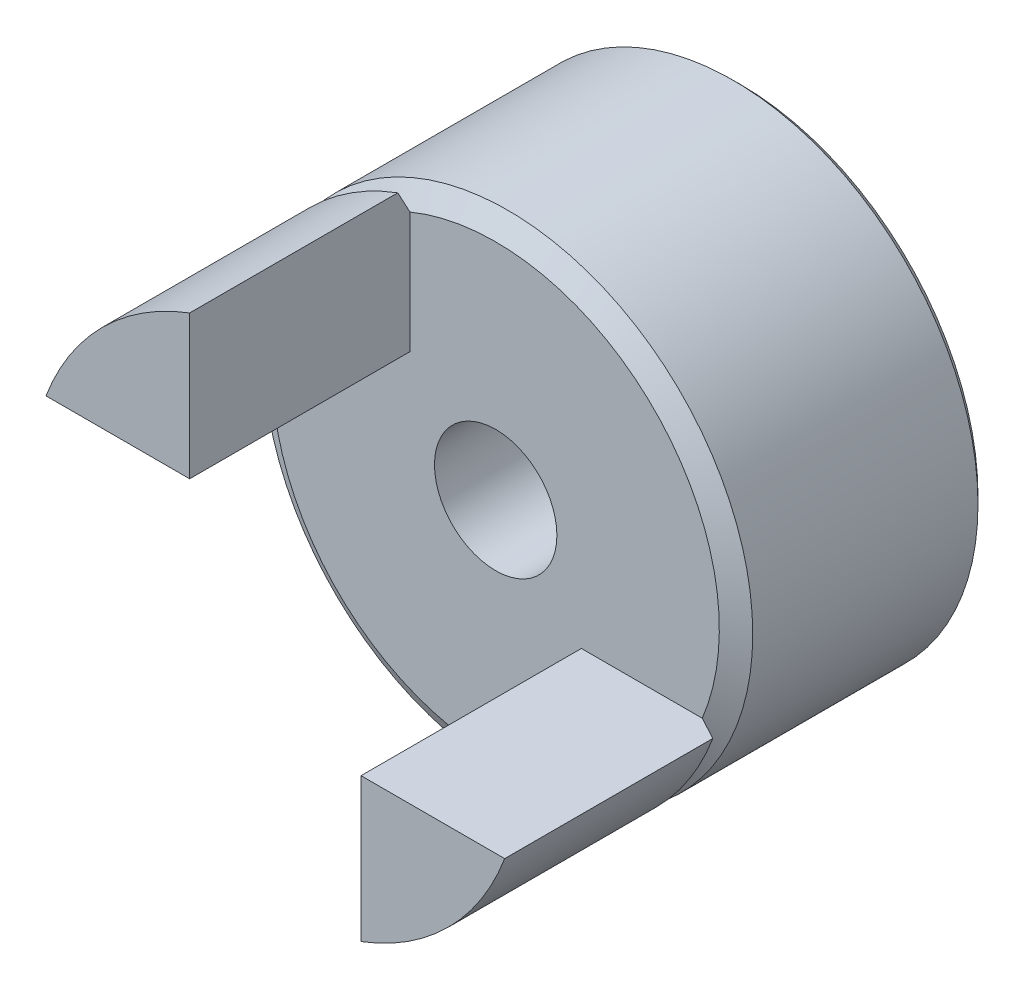
from build123d import *

# Parameters (mm, degrees)
SKETCH_1_R      = 10
SKETCH_1_R_2    = 2.5
EXTRUDE_1_DEPTH = 10
CHAMFER_1_SIZE  = 0.3
EXTRUDE_2_DEPTH = 9


with BuildPart() as part:
    # 스케치1 → 보스-돌출1 (new body)
    with BuildSketch(Plane.XY):
        Circle(SKETCH_1_R)
        Circle(SKETCH_1_R_2, mode=Mode.SUBTRACT)
    extrude(amount=EXTRUDE_1_DEPTH)

    # 모따기1
    chamfer_1_edges = [part.edges().sort_by_distance(p)[0] for p in [
        (-2.5, 0, 0),
        (-10, 0, 0),
    ]]
    chamfer(chamfer_1_edges, length=CHAMFER_1_SIZE)

    # 스케치2 → 보스-돌출2 (add)
    with BuildSketch(Plane.XY.offset(10)):
        with BuildLine():
            ThreePointArc((-3.5, 9.367496998), (-7.071067812, 7.071067812), (-9.367496998, 3.5))
            Line((-9.367496998, 3.5), (-3.5, 3.5))
            Line((-3.5, 3.5), (-3.5, 9.367496998))
        make_face()
        with BuildLine():
            Line((9.367496998, -3.5), (3.5, -3.5))
            Line((3.5, -3.5), (3.5, -9.367496998))
            ThreePointArc((3.5, -9.367496998), (7.071067812, -7.071067812), (9.367496998, -3.5))
        make_face()
    extrude(amount=EXTRUDE_2_DEPTH)

    # 스케치3 → 컷-회전1 (revolve, cut)
    with BuildSketch(Plane(origin=(0, 0, 0), x_dir=(1, 0, 0), z_dir=(0, 1, 0))):
        Polygon((9.133974596, -10), (10, -10.5), (10, -9.5), align=None)
    revolve(axis=Axis((0, 0, 0), (0, 0, 1)), mode=Mode.SUBTRACT)


solid = part.part
